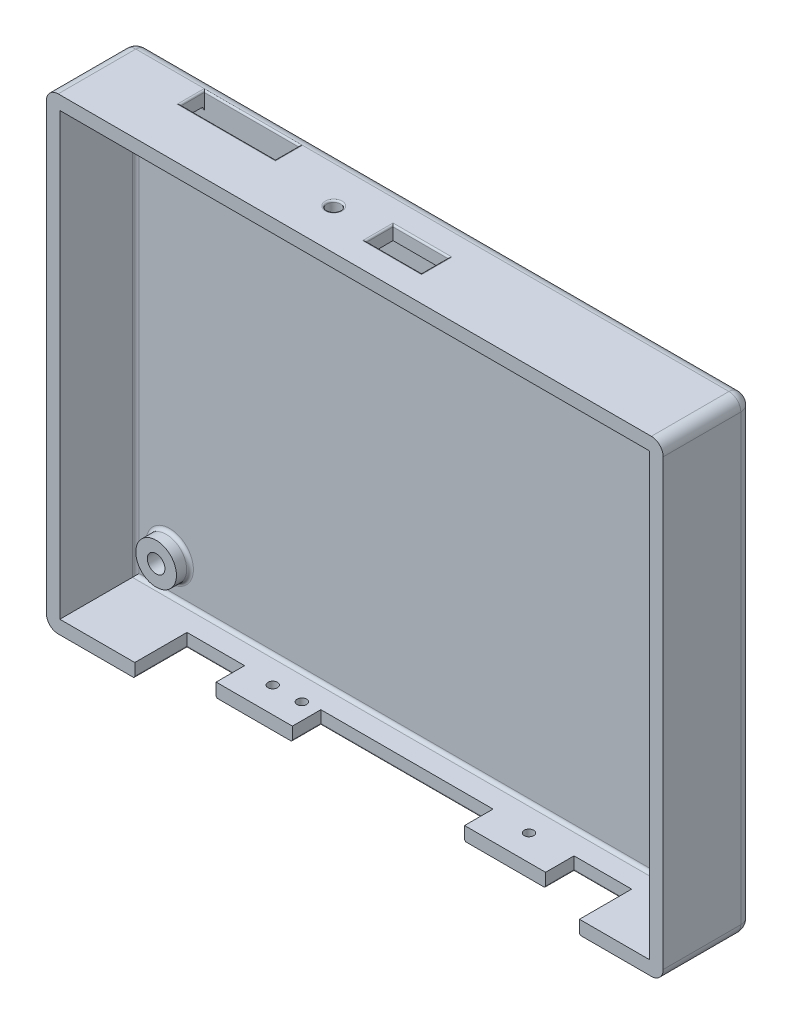
from build123d import *

# Parameters (mm, degrees)
SKETCH1_W           = 91
SKETCH1_H           = 69
BOSS_EXTRUDE1_DEPTH = 13.2
SHELL2_T            = -2
BOSS_EXTRUDE2_DEPTH = 2
SKETCH3_R           = 1.3
CUT_EXTRUDE1_DEPTH  = 4
SKETCH5_R           = 2.1
CUT_EXTRUDE2_DEPTH  = 1.7
SKETCH7_R           = 0.7
CUT_EXTRUDE4_DEPTH  = 2
SKETCH9_R           = 1
CUT_EXTRUDE6_DEPTH  = 2
SKETCH12_W          = 34
SKETCH12_H          = 28
CUT_EXTRUDE9_DEPTH  = 0.2
FILLET5_R           = 0.2
FILLET6_R           = 1.75
SKETCH6_W           = 8.6
SKETCH6_H           = 7.7
SKETCH6_W_2         = 8.5
SKETCH6_W_3         = 25.4
CUT_EXTRUDE10_DEPTH = 2
SKETCH8_W           = 14
SKETCH8_H           = 3.5
SKETCH8_W_2         = 8.2
SKETCH8_H_2         = 4
CUT_EXTRUDE12_DEPTH = 2
SKETCH16_W          = 0.1
SKETCH16_H          = 7.7
BOSS_EXTRUDE3_DEPTH = 2
SKETCH14_W          = 11.15
SKETCH14_H          = 3.5
SKETCH14_W_2        = 11.95
CUT_EXTRUDE13_DEPTH = 2
SKETCH17_W          = 0.1
SKETCH17_H          = 3.5
CUT_EXTRUDE14_DEPTH = 2
FILLET8_R           = 0.25
FILLET9_R           = 0.5


with BuildPart() as part:
    # Sketch1 → Boss-Extrude1 (new body)
    with BuildSketch(Plane.XY):
        with Locations((45.5, 34.5)):
            Rectangle(SKETCH1_W, SKETCH1_H)
    extrude(amount=BOSS_EXTRUDE1_DEPTH)

    # Shell2
    shell2_openings = [part.faces().sort_by_distance(p)[0] for p in [
        (45.5, 34.5, 13.2),
    ]]
    offset(amount=SHELL2_T, openings=shell2_openings, kind=Kind.INTERSECTION)

    # Sketch2 → Boss-Extrude2 (add)
    with BuildSketch(Plane.XY.offset(2)):
        with BuildLine():
            ThreePointArc((4, 7), (4.878679656, 4.878679656), (7, 4))
            Line((7, 4), (7, 7))
            Line((7, 7), (4, 7))
        make_face()
        with BuildLine():
            Line((7, 7), (7, 4))
            ThreePointArc((7, 4), (9.121320344, 4.878679656), (10, 7))
            ThreePointArc((10, 7), (7, 10), (4, 7))
            Line((4, 7), (7, 7))
        make_face()
        with BuildLine():
            ThreePointArc((10, 62), (9.121320344, 64.121320344), (7, 65))
            Line((7, 65), (7, 62))
            Line((7, 62), (4, 62))
            ThreePointArc((4, 62), (7, 59), (10, 62))
        make_face()
        with BuildLine():
            Line((7, 62), (7, 65))
            ThreePointArc((7, 65), (4.878679656, 64.121320344), (4, 62))
            Line((4, 62), (7, 62))
        make_face()
        with BuildLine():
            ThreePointArc((87, 62), (86.121320344, 64.121320344), (84, 65))
            Line((84, 65), (84, 62))
            Line((84, 62), (87, 62))
        make_face()
        with BuildLine():
            Line((84, 62), (84, 65))
            ThreePointArc((84, 65), (81.878679656, 59.878679656), (87, 62))
            Line((87, 62), (84, 62))
        make_face()
        with BuildLine():
            ThreePointArc((87, 7), (81.878679656, 9.121320344), (84, 4))
            Line((84, 4), (84, 7))
            Line((84, 7), (87, 7))
        make_face()
        with BuildLine():
            Line((84, 7), (84, 4))
            ThreePointArc((84, 4), (86.121320344, 4.878679656), (87, 7))
            Line((87, 7), (84, 7))
        make_face()
    extrude(amount=BOSS_EXTRUDE2_DEPTH)

    # Sketch3 → Cut-Extrude1 (cut)
    with BuildSketch(Plane.XY.offset(4)):
        with Locations((7, 62)):
            Circle(SKETCH3_R)
        with Locations((84, 62)):
            Circle(SKETCH3_R)
        with Locations((84, 7)):
            Circle(SKETCH3_R)
        with Locations((7, 7)):
            Circle(SKETCH3_R)
    extrude(amount=-CUT_EXTRUDE1_DEPTH, mode=Mode.SUBTRACT)

    # Sketch5 → Cut-Extrude2 (cut)
    with BuildSketch(Plane(origin=(0, 0, 0), x_dir=(-1, 0, 0), z_dir=(0, 0, -1))):
        with Locations((-84, 62)):
            Circle(SKETCH5_R)
        with Locations((-7, 62)):
            Circle(SKETCH5_R)
        with Locations((-7, 7)):
            Circle(SKETCH5_R)
        with Locations((-84, 7)):
            Circle(SKETCH5_R)
    extrude(amount=-CUT_EXTRUDE2_DEPTH, mode=Mode.SUBTRACT)

    # Sketch7 → Cut-Extrude4 (cut)
    with BuildSketch(Plane(origin=(0, 0, 0), x_dir=(-1, 0, 0), z_dir=(0, -1, 0))):
        with Locations(Location((-26.1, -5.9, 0), (0, 0, 90))):
            Circle(SKETCH7_R)
        with Locations(Location((-30.4, -5.9, 0), (0, 0, 90))):
            Circle(SKETCH7_R)
        with Locations(Location((-63.9, -5.9, 0), (0, 0, 90))):
            Circle(SKETCH7_R)
    extrude(amount=-CUT_EXTRUDE4_DEPTH, mode=Mode.SUBTRACT)

    # Sketch9 → Cut-Extrude6 (cut)
    with BuildSketch(Plane(origin=(0, 69, 0), x_dir=(1, 0, 0), z_dir=(0, 1, 0))):
        with Locations(Location((36.4, -7.2, 0), (0, 0, 270))):
            Circle(SKETCH9_R)
    extrude(amount=-CUT_EXTRUDE6_DEPTH, mode=Mode.SUBTRACT)

    # Sketch12 → Cut-Extrude9 (cut)
    with BuildSketch(Plane(origin=(0, 0, 0), x_dir=(-1, 0, 0), z_dir=(0, 0, -1))):
        with Locations((-45.5, 34.5)):
            Rectangle(SKETCH12_W, SKETCH12_H)
    extrude(amount=-CUT_EXTRUDE9_DEPTH, mode=Mode.SUBTRACT)

    # Fillet5
    fillet5_edges = [part.edges().sort_by_distance(p)[0] for p in [
        (45.5, 48.5, 0),
        (62.5, 34.5, 0),
        (28.5, 34.5, 0),
        (45.5, 20.5, 0),
    ]]
    fillet(fillet5_edges, radius=FILLET5_R - 0.0001)  # a hair under: the kernel refuses the full size

    # Fillet6
    fillet6_edges = [part.edges().sort_by_distance(p)[0] for p in [
        (45.5, 69, 0),
        (91, 34.5, 0),
        (45.5, 0, 0),
        (0, 34.5, 0),
        (0, 69, 6.6),
        (91, 69, 6.6),
        (91, 0, 6.6),
        (0, 0, 6.6),
    ]]
    fillet(fillet6_edges, radius=FILLET6_R)

    # Sketch6 → Cut-Extrude10 (cut)
    with BuildSketch(Plane(origin=(0, 0, 0), x_dir=(-1, 0, 0), z_dir=(0, -1, 0))):
        with Locations((-17.35, -9.35)):
            Rectangle(SKETCH6_W, SKETCH6_H)
        with Locations((-74.4, -9.35)):
            Rectangle(SKETCH6_W_2, SKETCH6_H)
        with Locations((-45.5, -9.35)):
            Rectangle(SKETCH6_W_3, SKETCH6_H)
    extrude(amount=-CUT_EXTRUDE10_DEPTH, mode=Mode.SUBTRACT)

    # Sketch8 → Cut-Extrude12 (cut)
    with BuildSketch(Plane(origin=(0, 69, 0), x_dir=(1, 0, 0), z_dir=(0, 1, 0))):
        with Locations((19.1, -3.75)):
            Rectangle(SKETCH8_W, SKETCH8_H)
        with Locations((47.3, -7.25)):
            Rectangle(SKETCH8_W_2, SKETCH8_H_2)
    extrude(amount=-CUT_EXTRUDE12_DEPTH, mode=Mode.SUBTRACT)

    # Sketch16 → Boss-Extrude3 (add)
    with BuildSketch(Plane(origin=(0, 0, 0), x_dir=(-1, 0, 0), z_dir=(0, -1, 0))):
        with Locations((-21.6, -9.35)):
            Rectangle(SKETCH16_W, SKETCH16_H)
    extrude(amount=-BOSS_EXTRUDE3_DEPTH)

    # Sketch14 → Cut-Extrude13 (cut)
    with BuildSketch(Plane(origin=(0, 0, 0), x_dir=(-1, 0, 0), z_dir=(0, -1, 0))):
        with Locations((-27.225, -11.45)):
            Rectangle(SKETCH14_W, SKETCH14_H)
        with Locations((-64.175, -11.45)):
            Rectangle(SKETCH14_W_2, SKETCH14_H)
    extrude(amount=-CUT_EXTRUDE13_DEPTH, mode=Mode.SUBTRACT)

    # Sketch17 → Cut-Extrude14 (cut)
    with BuildSketch(Plane(origin=(0, 0, 0), x_dir=(-1, 0, 0), z_dir=(0, -1, 0))):
        with Locations((-21.6, -11.45)):
            Rectangle(SKETCH17_W, SKETCH17_H)
    extrude(amount=-CUT_EXTRUDE14_DEPTH, mode=Mode.SUBTRACT)

    # Fillet8
    fillet8_edges = [part.edges().sort_by_distance(p)[0] for p in [
        (13.05, 0, 9.35),
        (17.3, 0, 5.5),
        (74.4, 0, 5.5),
        (78.65, 0, 9.35),
        (45.5, 0, 5.5),
        (58.2, 0, 7.6),
        (12.1, 69, 3.75),
        (19.1, 69, 5.5),
        (26.1, 69, 3.75),
        (19.1, 69, 2),
        (43.2, 69, 7.25),
        (47.3, 69, 9.25),
        (51.4, 69, 7.25),
        (47.3, 69, 5.25),
        (70.15, 0, 7.6),
        (32.8, 0, 7.6),
        (21.55, 0, 7.6),
        (26.1, 0, 6.6),
        (30.4, 0, 6.6),
        (63.9, 0, 6.6),
        (36.4, 69, 6.2),
    ]]
    fillet(fillet8_edges, radius=FILLET8_R - 0.0001)  # a hair under: the kernel refuses the full size

    # Fillet9
    fillet9_edges = [part.edges().sort_by_distance(p)[0] for p in [
        (2, 34.5, 2),
        (45.5, 2, 2),
        (89, 34.5, 2),
        (57.55, 67, 2),
        (7.05, 67, 2),
        (10, 7, 2),
        (7, 59, 2),
        (81, 62, 2),
        (84, 10, 2),
    ]]
    fillet(fillet9_edges, radius=FILLET9_R)


solid = part.part
